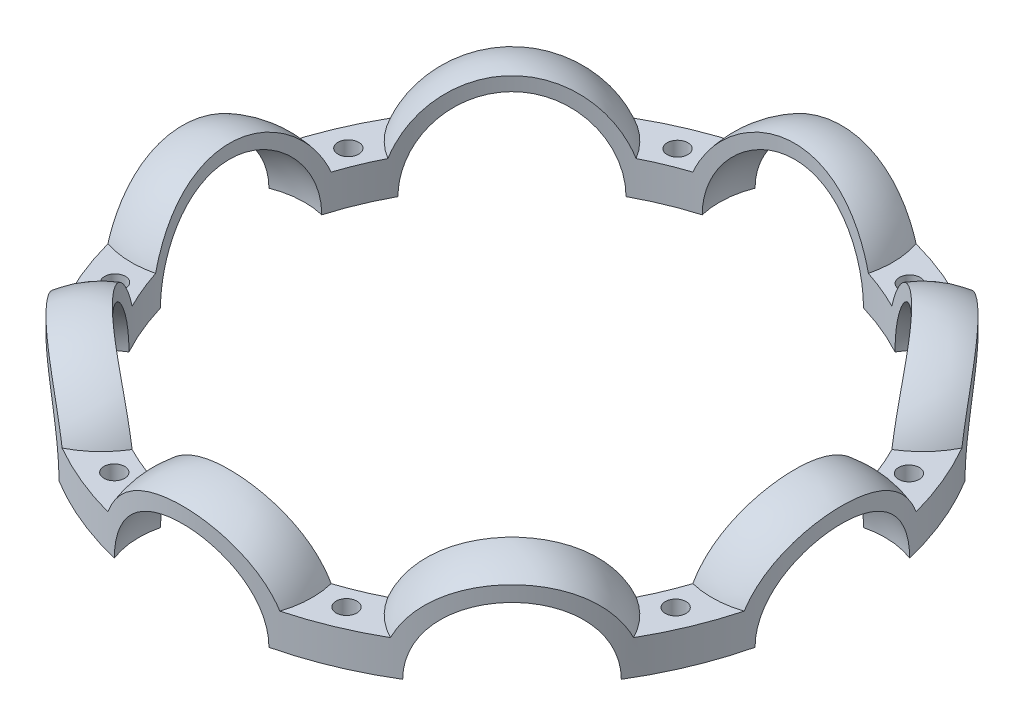
from build123d import *
from build123d.topology import SkipClean

# Parameters (mm, degrees)
REVOLVE1_ANGLE          = 180
CIRPATTERN1_COUNT       = 8
CUT_EXTRUDE3_DEPTH      = 46
CUT_EXTRUDE3_DEPTH_BACK = 35
SKETCH3_OUTSIDE_W       = 73.9
SKETCH3_OUTSIDE_H       = 73.9
SKETCH3_OUTSIDE_R       = 26
SKETCH3_OUTSIDE_R_2     = 16
SKETCH4_R               = 26
SKETCH4_R_2             = 16
BOSS_EXTRUDE1_DEPTH     = 2.5
CIRPATTERN3_COUNT       = 8
CUT_EXTRUDE4_DEPTH      = 38.429934683
CUT_EXTRUDE4_DEPTH_BACK = 38.429934683
SKETCH6_OUTSIDE_W       = 68.774
SKETCH6_OUTSIDE_H       = 68.774
SKETCH6_OUTSIDE_R       = 24.610931675
SKETCH6_OUTSIDE_R_2     = 18.808744825
CUT_EXTRUDE5_DEPTH      = 36.502055231
CUT_EXTRUDE5_DEPTH_BACK = 36.502055231
SKETCH7_R               = 20.44399263
CUT_EXTRUDE6_DEPTH      = 36.502055231
CUT_EXTRUDE6_DEPTH_BACK = 36.502055231
SKETCH8_OUTSIDE_W       = 65.214
SKETCH8_OUTSIDE_H       = 65.214
SKETCH8_OUTSIDE_R       = 23.839262585
SKETCH9_R               = 0.75
CUT_EXTRUDE7_DEPTH      = 35.012804805
CIRPATTERN4_COUNT       = 8


with BuildPart() as part:
    # Sketch1 → Revolve1 (revolve)
    with BuildSketch(Plane(origin=(0, 0, 0), x_dir=(1, 0, 0), z_dir=(0, 1, 0))):
        with BuildLine():
            Line((14, 0), (15, 0))
            ThreePointArc((15, 0), (21, -6), (27, 0))
            Line((27, 0), (28, 0))
            ThreePointArc((28, 0), (21, -7), (14, 0))
        make_face()
    revolve(axis=Axis((28, 0, 0), (-1, 0, 0)), revolution_arc=REVOLVE1_ANGLE)


with BuildPart() as cirpattern1_1:
    # CirPattern1: pattern copy
    add(part.part.rotate(Axis((0, -13.357205708, 0), (0, 1, 0)), 1 * 360 / CIRPATTERN1_COUNT))


with BuildPart() as cirpattern1_2:
    # CirPattern1: pattern copy
    add(part.part.rotate(Axis((0, -13.357205708, 0), (0, 1, 0)), 2 * 360 / CIRPATTERN1_COUNT))


with BuildPart() as cirpattern1_3:
    # CirPattern1: pattern copy
    add(part.part.rotate(Axis((0, -13.357205708, 0), (0, 1, 0)), 3 * 360 / CIRPATTERN1_COUNT))


with BuildPart() as cirpattern1_4:
    # CirPattern1: pattern copy
    add(part.part.rotate(Axis((0, -13.357205708, 0), (0, 1, 0)), 4 * 360 / CIRPATTERN1_COUNT))


with BuildPart() as cirpattern1_5:
    # CirPattern1: pattern copy
    add(part.part.rotate(Axis((0, -13.357205708, 0), (0, 1, 0)), 5 * 360 / CIRPATTERN1_COUNT))


with BuildPart() as cirpattern1_6:
    # CirPattern1: pattern copy
    add(part.part.rotate(Axis((0, -13.357205708, 0), (0, 1, 0)), 6 * 360 / CIRPATTERN1_COUNT))


with BuildPart() as cirpattern1_7:
    # CirPattern1: pattern copy
    add(part.part.rotate(Axis((0, -13.357205708, 0), (0, 1, 0)), 7 * 360 / CIRPATTERN1_COUNT))


with BuildPart() as cut_extrude3_tool:
    # Sketch3 outside → Cut-Extrude3 (new, two sides: drawn at the far end of the back side and taken through both)
    # profile 1 of 2: a face of its own
    with BuildSketch(Plane(origin=(0, 0, 0), x_dir=(1, 0, 0), z_dir=(0, 1, 0)).offset(-CUT_EXTRUDE3_DEPTH_BACK)):
        Rectangle(SKETCH3_OUTSIDE_W, SKETCH3_OUTSIDE_H)
        Circle(SKETCH3_OUTSIDE_R, mode=Mode.SUBTRACT)
    # profile 2 of 2: a face of its own
    with BuildSketch(Plane(origin=(0, 0, 0), x_dir=(1, 0, 0), z_dir=(0, 1, 0)).offset(-CUT_EXTRUDE3_DEPTH_BACK)):
        Circle(SKETCH3_OUTSIDE_R_2)
    extrude(amount=CUT_EXTRUDE3_DEPTH + CUT_EXTRUDE3_DEPTH_BACK)


with BuildPart() as part_1:
    add(part.part)

    # Cut-Extrude3: cut by cut_extrude3_tool
    add(cut_extrude3_tool.part, mode=Mode.SUBTRACT)



with BuildPart() as cirpattern1_1_1:
    add(cirpattern1_1.part)

    # Cut-Extrude3: cut by cut_extrude3_tool
    add(cut_extrude3_tool.part, mode=Mode.SUBTRACT)


with BuildPart() as cirpattern1_2_1:
    add(cirpattern1_2.part)

    # Cut-Extrude3: cut by cut_extrude3_tool
    add(cut_extrude3_tool.part, mode=Mode.SUBTRACT)


with BuildPart() as cirpattern1_3_1:
    add(cirpattern1_3.part)

    # Cut-Extrude3: cut by cut_extrude3_tool
    add(cut_extrude3_tool.part, mode=Mode.SUBTRACT)


with BuildPart() as cirpattern1_4_1:
    add(cirpattern1_4.part)

    # Cut-Extrude3: cut by cut_extrude3_tool
    add(cut_extrude3_tool.part, mode=Mode.SUBTRACT)


with BuildPart() as cirpattern1_5_1:
    add(cirpattern1_5.part)

    # Cut-Extrude3: cut by cut_extrude3_tool
    add(cut_extrude3_tool.part, mode=Mode.SUBTRACT)


with BuildPart() as cirpattern1_6_1:
    add(cirpattern1_6.part)

    # Cut-Extrude3: cut by cut_extrude3_tool
    add(cut_extrude3_tool.part, mode=Mode.SUBTRACT)


with BuildPart() as cirpattern1_7_1:
    add(cirpattern1_7.part)

    # Cut-Extrude3: cut by cut_extrude3_tool
    add(cut_extrude3_tool.part, mode=Mode.SUBTRACT)


with BuildPart() as part_2:
    with SkipClean():  # the faces are left unmerged after this step: merging them gives an invalid solid
        add(part_1.part)

        add(cirpattern1_1_1.part)  # Boss-Extrude1 merges CirPattern1_1

        add(cirpattern1_2_1.part)  # Boss-Extrude1 merges CirPattern1_2

        add(cirpattern1_3_1.part)  # Boss-Extrude1 merges CirPattern1_3

        add(cirpattern1_4_1.part)  # Boss-Extrude1 merges CirPattern1_4

        add(cirpattern1_5_1.part)  # Boss-Extrude1 merges CirPattern1_5

        add(cirpattern1_6_1.part)  # Boss-Extrude1 merges CirPattern1_6

        add(cirpattern1_7_1.part)  # Boss-Extrude1 merges CirPattern1_7
        # Sketch4 → Boss-Extrude1 (add)
        with BuildSketch(Plane(origin=(0, 0, 0), x_dir=(1, 0, 0), z_dir=(0, 1, 0))):
            Circle(SKETCH4_R)
            Circle(SKETCH4_R_2, mode=Mode.SUBTRACT)
        extrude(amount=BOSS_EXTRUDE1_DEPTH)

    # Sketch5 → Cut-Revolve1 (revolve, cut)
    with BuildSketch(Plane(origin=(0, 0, 0), x_dir=(1, 0, 0), z_dir=(0, 1, 0))):
        with BuildLine():
            Line((15, 0), (27, 0))
            ThreePointArc((27, 0), (21, -6), (15, 0))
        make_face()
    cut_revolve1 = revolve(axis=Axis((0, 0, 0), (1, 0, 0)), mode=Mode.SUBTRACT)

    # CirPattern3: Cut-Revolve1 ×8 about axis
    cirpattern3_axis = Axis((0, 0, 0), (0, 1, 0))
    for i in range(1, CIRPATTERN3_COUNT):
        add(cut_revolve1.rotate(cirpattern3_axis, i * 360 / CIRPATTERN3_COUNT), mode=Mode.SUBTRACT)

    # Sketch6 outside → Cut-Extrude4 (cut, two sides: drawn at the far end of the back side and taken through both)
    # profile 1 of 2: a face of its own
    with BuildSketch(Plane(origin=(0, 0, 0), x_dir=(1, 0, 0), z_dir=(0, 1, 0)).offset(-CUT_EXTRUDE4_DEPTH_BACK)):
        Rectangle(SKETCH6_OUTSIDE_W, SKETCH6_OUTSIDE_H)
        Circle(SKETCH6_OUTSIDE_R, mode=Mode.SUBTRACT)
    # profile 2 of 2: a face of its own
    with BuildSketch(Plane(origin=(0, 0, 0), x_dir=(1, 0, 0), z_dir=(0, 1, 0)).offset(-CUT_EXTRUDE4_DEPTH_BACK)):
        Circle(SKETCH6_OUTSIDE_R_2)
    extrude(amount=CUT_EXTRUDE4_DEPTH + CUT_EXTRUDE4_DEPTH_BACK, mode=Mode.SUBTRACT)

    # Sketch7 → Cut-Extrude5 (cut, two sides: drawn at the far end of the back side and taken through both)
    with BuildSketch(Plane(origin=(0, 0, 0), x_dir=(1, 0, 0), z_dir=(0, 1, 0)).offset(-CUT_EXTRUDE5_DEPTH_BACK)):
        Circle(SKETCH7_R)
    extrude(amount=CUT_EXTRUDE5_DEPTH + CUT_EXTRUDE5_DEPTH_BACK, mode=Mode.SUBTRACT)

    # Sketch8 outside → Cut-Extrude6 (cut, two sides: drawn at the far end of the back side and taken through both)
    with BuildSketch(Plane(origin=(0, 0, 0), x_dir=(1, 0, 0), z_dir=(0, 1, 0)).offset(-CUT_EXTRUDE6_DEPTH_BACK)):
        Rectangle(SKETCH8_OUTSIDE_W, SKETCH8_OUTSIDE_H)
        Circle(SKETCH8_OUTSIDE_R, mode=Mode.SUBTRACT)
    extrude(amount=CUT_EXTRUDE6_DEPTH + CUT_EXTRUDE6_DEPTH_BACK, mode=Mode.SUBTRACT)

    # Sketch9 → Cut-Extrude7 (cut, symmetric)
    with BuildSketch(Plane(origin=(0, 2.5, 0), x_dir=(1, 0, 0), z_dir=(0, 1, 0))):
        with Locations((-8.371599464, 20.344933581)):
            Circle(SKETCH9_R)
    cut_extrude7 = extrude(amount=CUT_EXTRUDE7_DEPTH, both=True, mode=Mode.SUBTRACT)

    # CirPattern4: Cut-Extrude7 ×8 about axis
    cirpattern4_axis = Axis((0, -0.344225472, 0), (0, 1, 0))
    for i in range(1, CIRPATTERN4_COUNT):
        add(cut_extrude7.rotate(cirpattern4_axis, i * 360 / CIRPATTERN4_COUNT), mode=Mode.SUBTRACT)


solid = part_2.part
